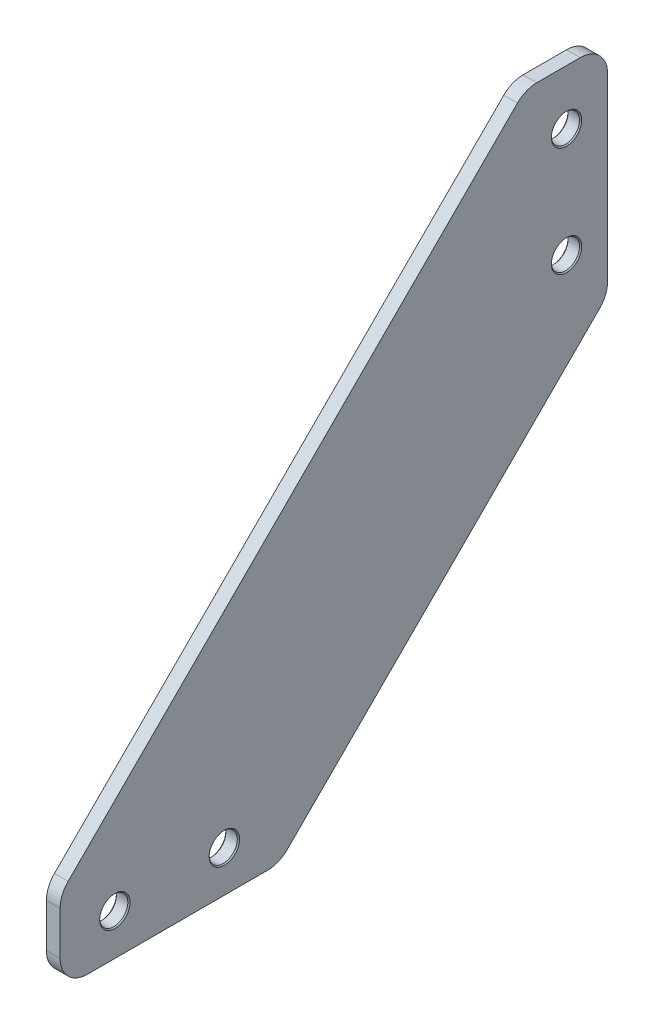
from build123d import *

# Parameters (mm, degrees)
F_1_8_IN_SHEET_METAL_DEPTH = 1.5875
F_1_4_CLEARANCE_HOLE1_D    = 6.5278
FILLET_1_4_IN_R            = 6.35
CHAMFER_1_100_IN_SIZE      = 0.254


with BuildPart() as part:
    # Sketch1 → 1/8 in Sheet Metal (new, symmetric)
    with BuildSketch(Plane(origin=(0, 0, 0), x_dir=(0, 0, -1), z_dir=(1, 0, 0))):
        Polygon((0, 127), (-19.05, 127), (-127, 19.05), (-127, 0), (-76.2, 0), (0, 76.2), align=None)
    extrude(amount=F_1_8_IN_SHEET_METAL_DEPTH, both=True)

    # 1/4 Clearance Hole1 (through all)
    with Locations(Plane(origin=(1.5875, 0, 0), x_dir=(0, 0, -1), z_dir=(1, 0, 0))):
        with Locations((-114.3, 9.525), (-88.9, 9.525), (-9.525, 88.9), (-9.525, 114.3)):
            Hole(F_1_4_CLEARANCE_HOLE1_D / 2)

    # Fillet 1/4 in
    fillet_1_4_in_edges = [part.edges().sort_by_distance(p)[0] for p in [
        (0, 76.2, 0),
        (0, 127, 0),
        (0, 127, 19.05),
        (0, 19.05, 127),
        (0, 0, 76.2),
        (0, 0, 127),
    ]]
    fillet(fillet_1_4_in_edges, radius=FILLET_1_4_IN_R)

    # Chamfer 1/100 in
    chamfer_1_100_in_edges = [part.edges().sort_by_distance(p)[0] for p in [
        (1.5875, 114.3, 6.2611),
        (-1.5875, 114.3, 6.2611),
        (1.5875, 88.9, 6.2611),
        (-1.5875, 88.9, 6.2611),
        (1.5875, 9.525, 111.0361),
        (-1.5875, 9.525, 111.0361),
        (1.5875, 9.525, 85.6361),
        (-1.5875, 9.525, 85.6361),
    ]]
    chamfer(chamfer_1_100_in_edges, length=CHAMFER_1_100_IN_SIZE)


solid = part.part
